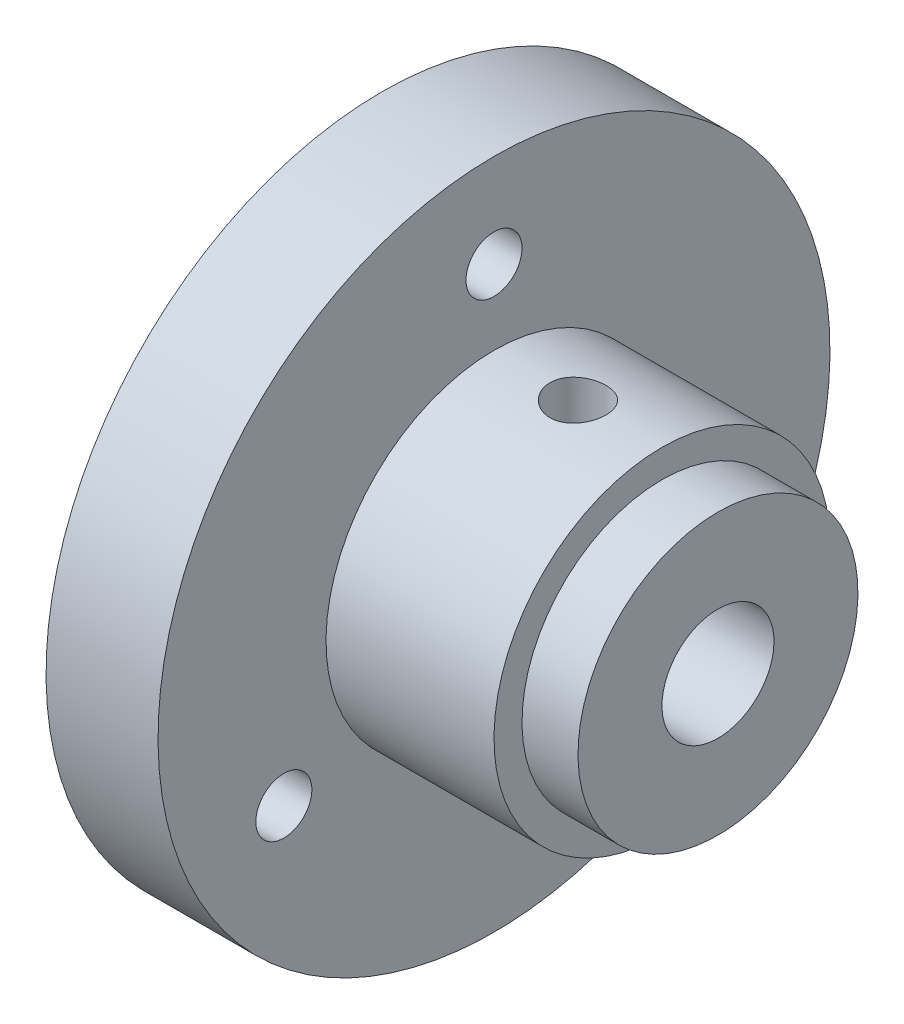
from build123d import *

# Parameters (mm, degrees)
ESQUISSE2_R             = 1.5
ENL_V_MAT_EXTRU_1_DEPTH = 29.142494559
ENL_V_MAT_EXTRU_2_REACH = 39.108
ESQUISSE3_R             = 1.5


with BuildPart() as part:
    # Esquisse1 → Révolution1 (revolve)
    with BuildSketch(Plane.XY):
        Polygon((0, 3), (-18, 3), (-18, 18), (-12, 18), (-12, 9), (-3, 9), (-3, 7.5), (0, 7.5), align=None)
    revolve(axis=Axis((0, 0, 0), (-1, 0, 0)))

    # Esquisse2 → Enlèv. mat.-Extru.1 (cut, through all)
    with BuildSketch(Plane(origin=(-12, 0, 0), x_dir=(0, 0, -1), z_dir=(1, 0, 0))):
        with Locations((0, 13)):
            Circle(ESQUISSE2_R)
        with Locations((11.258330249, -6.5)):
            Circle(ESQUISSE2_R)
        with Locations((-11.258330249, -6.5)):
            Circle(ESQUISSE2_R)
    extrude(amount=-ENL_V_MAT_EXTRU_1_DEPTH, mode=Mode.SUBTRACT)

    # Esquisse3 → Enlèv. mat.-Extru.2 (cut, up to next)
    with BuildSketch(Plane(origin=(0, 9, 0), x_dir=(1, 0, 0), z_dir=(0, 1, 0)), mode=Mode.PRIVATE) as enl_v_mat_extru_2_sk1:
        with Locations((-7.5, 0)):
            Circle(ESQUISSE3_R)
    enl_v_mat_extru_2_tool1 = extrude(enl_v_mat_extru_2_sk1.sketch, amount=-ENL_V_MAT_EXTRU_2_REACH, mode=Mode.PRIVATE) & part.part
    add(enl_v_mat_extru_2_tool1.solids().sort_by_distance((-7.5, 9, 0))[0], mode=Mode.SUBTRACT)


solid = part.part
